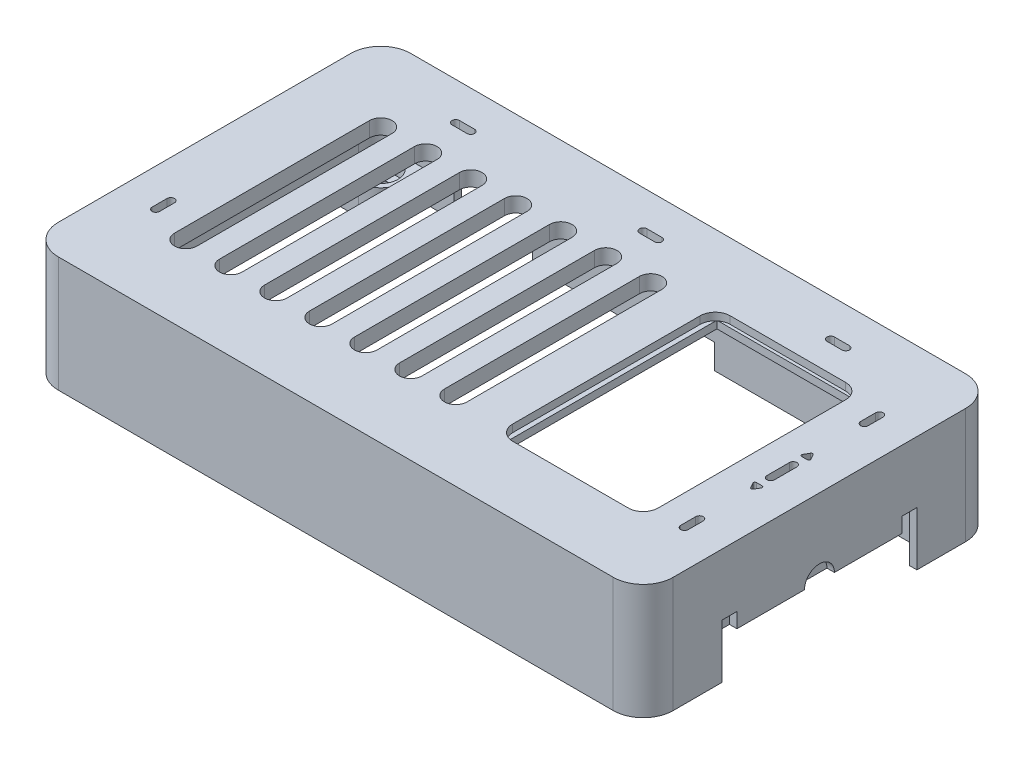
from build123d import *

# Parameters (mm, degrees)
EXTRUDE_1_DEPTH      = 2
CUT_EXTRUDE_1_DEPTH  = 1
SKETCH_3_W           = 2.5
SKETCH_3_H           = 2.5
SKETCH_3_W_2         = 18.142180945
SKETCH_3_H_2         = 32
CUT_EXTRUDE_2_DEPTH  = 1
CUT_EXTRUDE_3_DEPTH  = 94.171884171
EXTRUDE_2_DEPTH      = 13.4
SKETCH_6_W           = 1
SKETCH_6_H           = 10.5
SKETCH_6_W_2         = 10.5
SKETCH_6_H_2         = 1
CUT_EXTRUDE_4_DEPTH  = 10.5
SKETCH_7_W           = 9
SKETCH_7_H           = 1
CUT_EXTRUDE_5_DEPTH  = 3.3
SKETCH_8_W           = 1
SKETCH_8_H           = 26
CUT_EXTRUDE_6_DEPTH  = 5.2
CUT_EXTRUDE_7_REACH  = 97.274
SKETCH_9_R           = 2
SKETCH_9_W           = 2
SKETCH_9_H           = 4
EXTRUDE_4_DEPTH      = 4
SKETCH_18_W          = 30
SKETCH_18_H          = 9
EXTRUDE_5_DEPTH      = 1
EXTRUDE_START        = -4
EXTRUDE_6_DEPTH      = 4
CUT_EXTRUDE_9_REACH  = 96.415
SKETCH_20_R          = 1
SKETCH_21_R          = 2.3
CUT_EXTRUDE_10_DEPTH = 2


with BuildPart() as part:
    # 草图1 → 凸台-拉伸1 (new body)
    with BuildSketch(Plane(origin=(0, 0, 0), x_dir=(1, 0, 0), z_dir=(0, 1, 0))):
        with BuildLine():
            Line((-1, -3), (-1, -42))
            ThreePointArc((-1, -42), (0.171572875, -44.828427125), (3, -46))
            Line((3, -46), (77, -46))
            ThreePointArc((77, -46), (79.828427125, -44.828427125), (81, -42))
            Line((81, -42), (81, -3))
            ThreePointArc((81, -3), (79.828427125, -0.171572875), (77, 1))
            Line((77, 1), (3, 1))
            ThreePointArc((3, 1), (0.171572875, -0.171572875), (-1, -3))
        make_face()
    extrude(amount=-EXTRUDE_1_DEPTH)

    # 草图2 → 切除-拉伸1 (cut)
    with BuildSketch(Plane(origin=(0, 0, 0), x_dir=(1, 0, 0), z_dir=(0, 1, 0))):
        with BuildLine():
            Line((39, -3.5), (41, -3.5))
            ThreePointArc((41, -3.5), (41.5, -4), (41, -4.5))
            Line((41, -4.5), (39, -4.5))
            ThreePointArc((39, -4.5), (38.5, -4), (39, -3.5))
        make_face()
        with BuildLine():
            Line((14, -3.5), (16, -3.5))
            ThreePointArc((16, -3.5), (16.5, -4), (16, -4.5))
            Line((16, -4.5), (14, -4.5))
            ThreePointArc((14, -4.5), (13.5, -4), (14, -3.5))
        make_face()
        with BuildLine():
            Line((64, -3.5), (66, -3.5))
            ThreePointArc((66, -3.5), (66.5, -4), (66, -4.5))
            Line((66, -4.5), (64, -4.5))
            ThreePointArc((64, -4.5), (63.5, -4), (64, -3.5))
        make_face()
        with BuildLine():
            Line((76.5, -21), (76.5, -24))
            ThreePointArc((76.5, -24), (76, -24.5), (75.5, -24))
            Line((75.5, -24), (75.5, -21))
            ThreePointArc((75.5, -21), (76, -20.5), (76.5, -21))
        make_face()
        with BuildLine():
            Line((75.826794919, -18.514), (75.437083488, -19.189))
            ThreePointArc((75.437083488, -19.189), (75.437083488, -19.389), (75.610288568, -19.489))
            Line((75.610288568, -19.489), (76.389711432, -19.489))
            ThreePointArc((76.389711432, -19.489), (76.562916512, -19.389), (76.562916512, -19.189))
            Line((76.562916512, -19.189), (76.173205081, -18.514))
            ThreePointArc((76.173205081, -18.514), (76, -18.414), (75.826794919, -18.514))
        make_face()
        with BuildLine():
            Line((76.173205081, -26.486), (76.562916512, -25.811))
            ThreePointArc((76.562916512, -25.811), (76.562916512, -25.611), (76.389711432, -25.511))
            Line((76.389711432, -25.511), (75.610288568, -25.511))
            ThreePointArc((75.610288568, -25.511), (75.437083488, -25.611), (75.437083488, -25.811))
            Line((75.437083488, -25.811), (75.826794919, -26.486))
            ThreePointArc((75.826794919, -26.486), (76, -26.586), (76.173205081, -26.486))
        make_face()
        with BuildLine():
            Line((76.5, -9.5), (76.5, -11.5))
            ThreePointArc((76.5, -11.5), (76, -12), (75.5, -11.5))
            Line((75.5, -11.5), (75.5, -9.5))
            ThreePointArc((75.5, -9.5), (76, -9), (76.5, -9.5))
        make_face()
        with BuildLine():
            Line((76.5, -33.5), (76.5, -35.5))
            ThreePointArc((76.5, -35.5), (76, -36), (75.5, -35.5))
            Line((75.5, -35.5), (75.5, -33.5))
            ThreePointArc((75.5, -33.5), (76, -33), (76.5, -33.5))
        make_face()
        with BuildLine():
            Line((4.5, -32), (4.5, -34))
            ThreePointArc((4.5, -34), (4, -34.5), (3.5, -34))
            Line((3.5, -34), (3.5, -32))
            ThreePointArc((3.5, -32), (4, -31.5), (4.5, -32))
        make_face()
        with BuildLine():
            Line((70, -8), (54.597819055, -8))
            ThreePointArc((54.597819055, -8), (53.183605493, -8.585786438), (52.597819055, -10))
            Line((52.597819055, -10), (52.597819055, -35))
            ThreePointArc((52.597819055, -35), (53.183605493, -36.414213562), (54.597819055, -37))
            Line((54.597819055, -37), (70, -37))
            ThreePointArc((70, -37), (71.414213562, -36.414213562), (72, -35))
            Line((72, -35), (72, -10))
            ThreePointArc((72, -10), (71.414213562, -8.585786438), (70, -8))
        make_face()
        with BuildLine():
            Line((11, -9.5), (11, -35.5))
            ThreePointArc((11, -35.5), (9.5, -37), (8, -35.5))
            Line((8, -35.5), (8, -9.5))
            ThreePointArc((8, -9.5), (9.5, -8), (11, -9.5))
        make_face()
        with BuildLine():
            Line((17, -9.5), (17, -35.5))
            ThreePointArc((17, -35.5), (15.5, -37), (14, -35.5))
            Line((14, -35.5), (14, -9.5))
            ThreePointArc((14, -9.5), (15.5, -8), (17, -9.5))
        make_face()
        with BuildLine():
            Line((23, -9.5), (23, -35.5))
            ThreePointArc((23, -35.5), (21.5, -37), (20, -35.5))
            Line((20, -35.5), (20, -9.5))
            ThreePointArc((20, -9.5), (21.5, -8), (23, -9.5))
        make_face()
        with BuildLine():
            Line((29, -9.5), (29, -35.5))
            ThreePointArc((29, -35.5), (27.5, -37), (26, -35.5))
            Line((26, -35.5), (26, -9.5))
            ThreePointArc((26, -9.5), (27.5, -8), (29, -9.5))
        make_face()
        with BuildLine():
            Line((35, -9.5), (35, -35.5))
            ThreePointArc((35, -35.5), (33.5, -37), (32, -35.5))
            Line((32, -35.5), (32, -9.5))
            ThreePointArc((32, -9.5), (33.5, -8), (35, -9.5))
        make_face()
        with BuildLine():
            Line((41, -9.5), (41, -35.5))
            ThreePointArc((41, -35.5), (39.5, -37), (38, -35.5))
            Line((38, -35.5), (38, -9.5))
            ThreePointArc((38, -9.5), (39.5, -8), (41, -9.5))
        make_face()
        with BuildLine():
            Line((47, -9.5), (47, -35.5))
            ThreePointArc((47, -35.5), (45.5, -37), (44, -35.5))
            Line((44, -35.5), (44, -9.5))
            ThreePointArc((44, -9.5), (45.5, -8), (47, -9.5))
        make_face()
    extrude(amount=-CUT_EXTRUDE_1_DEPTH, mode=Mode.SUBTRACT)

    # 草图3 → 切除-拉伸2 (cut)
    with BuildSketch(Plane.XZ.offset(2)):
        with Locations((76, 19.064)):
            Rectangle(SKETCH_3_W, SKETCH_3_H)
        with Locations((76, 22.5)):
            Rectangle(SKETCH_3_W, SKETCH_3_H)
        with Locations((76, 25.936)):
            Rectangle(SKETCH_3_W, SKETCH_3_H)
        with Locations((76, 10.5)):
            Rectangle(SKETCH_3_W, SKETCH_3_H)
        with Locations((76, 34.5)):
            Rectangle(SKETCH_3_W, SKETCH_3_H)
        Polygon((63.75, 5.25), (63.75, 2.75), (66.25, 2.75), (66.25, 5.25), (66.25, 6.25), (63.75, 6.25), align=None)
        Polygon((38.75, 5.25), (38.75, 2.75), (41.25, 2.75), (41.25, 5.25), (41.25, 6.25), (38.75, 6.25), align=None)
        Polygon((13.75, 5.25), (13.75, 2.75), (16.25, 2.75), (16.25, 5.25), (16.25, 6.25), (13.75, 6.25), align=None)
        with Locations((4, 33)):
            Rectangle(SKETCH_3_W, SKETCH_3_H)
        with Locations((62.298909528, 24.4)):
            Rectangle(SKETCH_3_W_2, SKETCH_3_H_2)
    extrude(amount=-CUT_EXTRUDE_2_DEPTH, mode=Mode.SUBTRACT)

    # 草图4 → 切除-拉伸3 (cut, through all)
    with BuildSketch(Plane(origin=(0, 0, 0), x_dir=(1, 0, 0), z_dir=(0, 1, 0))):
        with BuildLine():
            Line((11, -35.5), (11, -9.5))
            ThreePointArc((11, -9.5), (9.5, -8), (8, -9.5))
            Line((8, -9.5), (8, -35.5))
            ThreePointArc((8, -35.5), (9.5, -37), (11, -35.5))
        make_face()
        with BuildLine():
            Line((23, -35.5), (23, -9.5))
            ThreePointArc((23, -9.5), (21.5, -8), (20, -9.5))
            Line((20, -9.5), (20, -35.5))
            ThreePointArc((20, -35.5), (21.5, -37), (23, -35.5))
        make_face()
        with BuildLine():
            Line((17, -35.5), (17, -9.5))
            ThreePointArc((17, -9.5), (15.5, -8), (14, -9.5))
            Line((14, -9.5), (14, -35.5))
            ThreePointArc((14, -35.5), (15.5, -37), (17, -35.5))
        make_face()
        with BuildLine():
            Line((35, -35.5), (35, -9.5))
            ThreePointArc((35, -9.5), (33.5, -8), (32, -9.5))
            Line((32, -9.5), (32, -35.5))
            ThreePointArc((32, -35.5), (33.5, -37), (35, -35.5))
        make_face()
        with BuildLine():
            Line((29, -35.5), (29, -9.5))
            ThreePointArc((29, -9.5), (27.5, -8), (26, -9.5))
            Line((26, -9.5), (26, -35.5))
            ThreePointArc((26, -35.5), (27.5, -37), (29, -35.5))
        make_face()
        with BuildLine():
            Line((47, -35.5), (47, -9.5))
            ThreePointArc((47, -9.5), (45.5, -8), (44, -9.5))
            Line((44, -9.5), (44, -35.5))
            ThreePointArc((44, -35.5), (45.5, -37), (47, -35.5))
        make_face()
        with BuildLine():
            Line((38, -9.5), (38, -35.5))
            ThreePointArc((38, -35.5), (39.5, -37), (41, -35.5))
            Line((41, -35.5), (41, -9.5))
            ThreePointArc((41, -9.5), (39.5, -8), (38, -9.5))
        make_face()
    extrude(amount=-CUT_EXTRUDE_3_DEPTH, mode=Mode.SUBTRACT)

    # 草图5 → 凸台-拉伸2 (add)
    with BuildSketch(Plane.XZ.offset(2)):
        with BuildLine():
            Line((3, -1), (77, -1))
            ThreePointArc((77, -1), (79.828427125, 0.171572875), (81, 3))
            Line((81, 3), (81, 42))
            ThreePointArc((81, 42), (79.828427125, 44.828427125), (77, 46))
            Line((77, 46), (3, 46))
            ThreePointArc((3, 46), (0.171572875, 44.828427125), (-1, 42))
            Line((-1, 42), (-1, 3))
            ThreePointArc((-1, 3), (0.171572875, 0.171572875), (3, -1))
        make_face()
        with BuildLine():
            Line((3, 0), (77, 0))
            ThreePointArc((77, 0), (79.121320344, 0.878679656), (80, 3))
            Line((80, 3), (80, 42))
            ThreePointArc((80, 42), (79.121320344, 44.121320344), (77, 45))
            Line((77, 45), (3, 45))
            ThreePointArc((3, 45), (0.878679656, 44.121320344), (0, 42))
            Line((0, 42), (0, 3))
            ThreePointArc((0, 3), (0.878679656, 0.878679656), (3, 0))
        make_face(mode=Mode.SUBTRACT)
    extrude(amount=EXTRUDE_2_DEPTH)

    # 草图6 → 切除-拉伸4 (cut)
    with BuildSketch(Plane.XZ.offset(15.4)):
        with Locations((-0.5, 33)):
            Rectangle(SKETCH_6_W, SKETCH_6_H)
        with Locations((15, -0.5)):
            Rectangle(SKETCH_6_W_2, SKETCH_6_H_2)
    extrude(amount=-CUT_EXTRUDE_4_DEPTH, mode=Mode.SUBTRACT)

    # 草图7 → 切除-拉伸5 (cut)
    with BuildSketch(Plane.XZ.offset(15.4)):
        with Locations((40, -0.5)):
            Rectangle(SKETCH_7_W, SKETCH_7_H)
        with Locations((65, -0.5)):
            Rectangle(SKETCH_7_W, SKETCH_7_H)
    extrude(amount=-CUT_EXTRUDE_5_DEPTH, mode=Mode.SUBTRACT)

    # 草图8 → 切除-拉伸6 (cut)
    with BuildSketch(Plane.XZ.offset(15.4)):
        with Locations((80.5, 22.5)):
            Rectangle(SKETCH_8_W, SKETCH_8_H)
    extrude(amount=-CUT_EXTRUDE_6_DEPTH, mode=Mode.SUBTRACT)

    # 草图9 → 切除-拉伸7 (cut, up to next)
    with BuildSketch(Plane(origin=(81, 0, 0), x_dir=(0, 0, -1), z_dir=(1, 0, 0)), mode=Mode.PRIVATE) as cut_extrude_7_sk1:
        with Locations((-22.5, -10.2)):
            Circle(SKETCH_9_R)
    cut_extrude_7_tool1 = extrude(cut_extrude_7_sk1.sketch, amount=-CUT_EXTRUDE_7_REACH, mode=Mode.PRIVATE) & part.part
    # 草图9 → 切除-拉伸7 (cut, up to next)
    with BuildSketch(Plane(origin=(81, 0, 0), x_dir=(0, 0, -1), z_dir=(1, 0, 0)), mode=Mode.PRIVATE) as cut_extrude_7_sk2:
        with Locations((-34.5, -10.2)):
            Rectangle(SKETCH_9_W, SKETCH_9_H)
    cut_extrude_7_tool2 = extrude(cut_extrude_7_sk2.sketch, amount=-CUT_EXTRUDE_7_REACH, mode=Mode.PRIVATE) & part.part
    # 草图9 → 切除-拉伸7 (cut, up to next)
    with BuildSketch(Plane(origin=(81, 0, 0), x_dir=(0, 0, -1), z_dir=(1, 0, 0)), mode=Mode.PRIVATE) as cut_extrude_7_sk3:
        with Locations((-10.5, -10.2)):
            Rectangle(SKETCH_9_W, SKETCH_9_H)
    cut_extrude_7_tool3 = extrude(cut_extrude_7_sk3.sketch, amount=-CUT_EXTRUDE_7_REACH, mode=Mode.PRIVATE) & part.part
    add(cut_extrude_7_tool1.solids().sort_by_distance((81, -10.2, 22.5))[0], mode=Mode.SUBTRACT)
    add(cut_extrude_7_tool2.solids().sort_by_distance((81, -10.2, 34.5))[0], mode=Mode.SUBTRACT)
    add(cut_extrude_7_tool3.solids().sort_by_distance((81, -10.2, 10.5))[0], mode=Mode.SUBTRACT)

    # 草图17 → 凸台-拉伸4 (add)
    with BuildSketch(Plane.ZY.offset(-80)):
        Polygon((7, -5.2), (7, -14.2), (8, -14.2), (8, -6.2), (37, -6.2), (37, -5.2), align=None)
    extrude(amount=EXTRUDE_4_DEPTH)

    # 草图18 → 凸台-拉伸5 (add)
    with BuildSketch(Plane.ZY.offset(-76)):
        with Locations((22, -9.7)):
            Rectangle(SKETCH_18_W, SKETCH_18_H)
    extrude(amount=EXTRUDE_5_DEPTH)

    # 草图19 → 凸台-拉伸6 (add)
    with BuildSketch(Plane.XZ.offset(15.4).offset(EXTRUDE_START)):
        with BuildLine():
            Line((3, 39), (0, 39))
            Line((0, 39), (0, 42))
            ThreePointArc((0, 42), (0.878679656, 44.121320344), (3, 45))
            Line((3, 45), (6, 45))
            Line((6, 45), (6, 42))
            ThreePointArc((6, 42), (5.121320344, 39.878679656), (3, 39))
        make_face()
        with BuildLine():
            Line((3, 6), (0, 6))
            Line((0, 6), (0, 3))
            ThreePointArc((0, 3), (0.878679656, 0.878679656), (3, 0))
            Line((3, 0), (6, 0))
            Line((6, 0), (6, 3))
            ThreePointArc((6, 3), (5.121320344, 5.121320344), (3, 6))
        make_face()
        with BuildLine():
            Line((77, 6), (80, 6))
            Line((80, 6), (80, 3))
            ThreePointArc((80, 3), (79.121320344, 0.878679656), (77, 0))
            Line((77, 0), (74, 0))
            Line((74, 0), (74, 3))
            ThreePointArc((74, 3), (74.878679656, 5.121320344), (77, 6))
        make_face()
        with BuildLine():
            Line((74, 42), (74, 45))
            Line((74, 45), (77, 45))
            ThreePointArc((77, 45), (79.121320344, 44.121320344), (80, 42))
            Line((80, 42), (80, 39))
            Line((80, 39), (77, 39))
            ThreePointArc((77, 39), (74.878679656, 39.878679656), (74, 42))
        make_face()
    extrude(amount=EXTRUDE_6_DEPTH)

    # 草图20 → 切除-拉伸9 (cut, up to next)
    with BuildSketch(Plane.XZ.offset(15.4), mode=Mode.PRIVATE) as cut_extrude_9_sk1:
        with Locations((3, 42)):
            Circle(SKETCH_20_R)
    cut_extrude_9_tool1 = extrude(cut_extrude_9_sk1.sketch, amount=-CUT_EXTRUDE_9_REACH, mode=Mode.PRIVATE) & part.part
    # 草图20 → 切除-拉伸9 (cut, up to next)
    with BuildSketch(Plane.XZ.offset(15.4), mode=Mode.PRIVATE) as cut_extrude_9_sk2:
        with Locations((77, 42)):
            Circle(SKETCH_20_R)
    cut_extrude_9_tool2 = extrude(cut_extrude_9_sk2.sketch, amount=-CUT_EXTRUDE_9_REACH, mode=Mode.PRIVATE) & part.part
    # 草图20 → 切除-拉伸9 (cut, up to next)
    with BuildSketch(Plane.XZ.offset(15.4), mode=Mode.PRIVATE) as cut_extrude_9_sk3:
        with Locations((3, 3)):
            Circle(SKETCH_20_R)
    cut_extrude_9_tool3 = extrude(cut_extrude_9_sk3.sketch, amount=-CUT_EXTRUDE_9_REACH, mode=Mode.PRIVATE) & part.part
    # 草图20 → 切除-拉伸9 (cut, up to next)
    with BuildSketch(Plane.XZ.offset(15.4), mode=Mode.PRIVATE) as cut_extrude_9_sk4:
        with Locations((77, 3)):
            Circle(SKETCH_20_R)
    cut_extrude_9_tool4 = extrude(cut_extrude_9_sk4.sketch, amount=-CUT_EXTRUDE_9_REACH, mode=Mode.PRIVATE) & part.part
    add(cut_extrude_9_tool1.solids().sort_by_distance((3, -15.4, 42))[0], mode=Mode.SUBTRACT)
    add(cut_extrude_9_tool2.solids().sort_by_distance((77, -15.4, 42))[0], mode=Mode.SUBTRACT)
    add(cut_extrude_9_tool3.solids().sort_by_distance((3, -15.4, 3))[0], mode=Mode.SUBTRACT)
    add(cut_extrude_9_tool4.solids().sort_by_distance((77, -15.4, 3))[0], mode=Mode.SUBTRACT)

    # 草图21 → 切除-拉伸10 (cut)
    with BuildSketch(Plane(origin=(0, -11.4, 0), x_dir=(1, 0, 0), z_dir=(0, 1, 0))):
        with Locations((3, -3)):
            Circle(SKETCH_21_R)
        with Locations((77, -3)):
            Circle(SKETCH_21_R)
        with Locations((77, -42)):
            Circle(SKETCH_21_R)
        with Locations((3, -42)):
            Circle(SKETCH_21_R)
    extrude(amount=-CUT_EXTRUDE_10_DEPTH, mode=Mode.SUBTRACT)


solid = part.part
